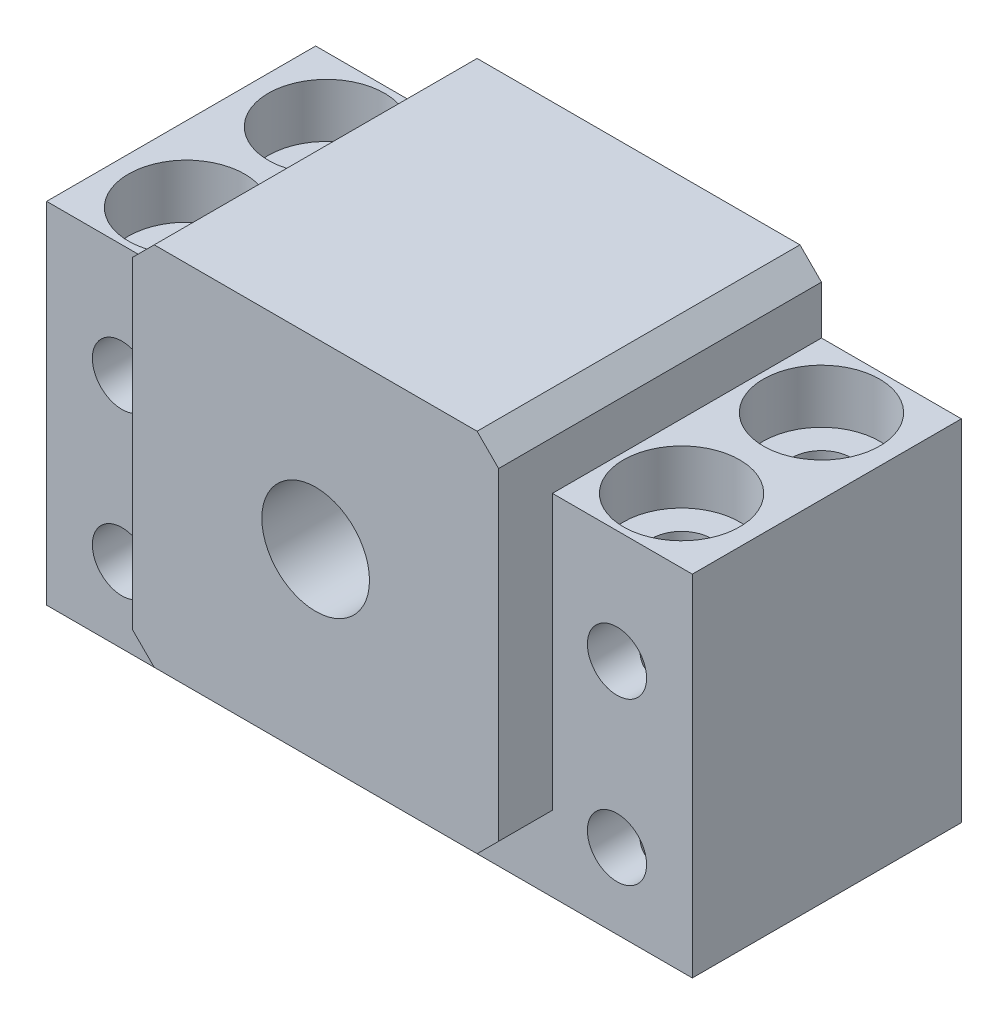
from build123d import *
from build123d.topology import SkipClean

# Parameters (mm, degrees)
SKETCH1_R           = 5
BOSS_EXTRUDE1_DEPTH = 5
BOSS_EXTRUDE2_START = 25
SKETCH2_R           = 5
SKETCH2_R_2         = 2.75
BOSS_EXTRUDE2_DEPTH = 25
SKETCH3_R           = 2.75
CUT_EXTRUDE1_DEPTH  = 56.190578906
SKETCH4_R           = 5.4
CUT_EXTRUDE2_DEPTH  = 5


with BuildPart() as part:
    # Sketch1 → Boss-Extrude1 (new body)
    with BuildSketch(Plane.XY):
        Polygon((15, 17), (-15, 17), (-17, 15), (-17, -15), (-15, -17), (15, -17), (17, -15), (17, 15), align=None)
        Circle(SKETCH1_R, mode=Mode.SUBTRACT)
    extrude(amount=BOSS_EXTRUDE1_DEPTH)

    # Sketch2 → Boss-Extrude2 (add)
    with SkipClean():  # the faces are left unmerged after this step: merging them gives an invalid solid
        with BuildSketch(Plane(origin=(0, 0, 0), x_dir=(-1, 0, 0), z_dir=(0, 0, -1)).offset(BOSS_EXTRUDE2_START)):
            Polygon((15, 17), (-15, 17), (-17, 15), (-17, 10.5), (-30, 10.5), (-30, -22), (30, -22), (30, 10.5), (17, 10.5), (17, 15), align=None)
            Circle(SKETCH2_R, mode=Mode.SUBTRACT)
            with Locations((-23, 0)):
                Circle(SKETCH2_R_2, mode=Mode.SUBTRACT)
            with Locations((-23, -15)):
                Circle(SKETCH2_R_2, mode=Mode.SUBTRACT)
            with Locations((23, -15)):
                Circle(SKETCH2_R_2, mode=Mode.SUBTRACT)
            with Locations((23, 0)):
                Circle(SKETCH2_R_2, mode=Mode.SUBTRACT)
        extrude(amount=-BOSS_EXTRUDE2_DEPTH)

    # Sketch3 → Cut-Extrude1 (cut, through all)
    with SkipClean():  # the faces are left unmerged after this step: merging them gives an invalid solid
        with BuildSketch(Plane.XZ.offset(22)):
            with Locations((-23, -6)):
                Circle(SKETCH3_R)
            with Locations((-23, -19)):
                Circle(SKETCH3_R)
            with Locations((23, -6)):
                Circle(SKETCH3_R)
            with Locations((23, -19)):
                Circle(SKETCH3_R)
        extrude(amount=-CUT_EXTRUDE1_DEPTH, mode=Mode.SUBTRACT)

    # Sketch4 → Cut-Extrude2 (cut)
    with SkipClean():  # the faces are left unmerged after this step: merging them gives an invalid solid
        with BuildSketch(Plane(origin=(0, 10.5, 0), x_dir=(1, 0, 0), z_dir=(0, 1, 0))):
            with Locations((23, 6)):
                Circle(SKETCH4_R)
            with Locations((23, 19)):
                Circle(SKETCH4_R)
            with Locations((-23, 19)):
                Circle(SKETCH4_R)
            with Locations((-23, 6)):
                Circle(SKETCH4_R)
        extrude(amount=-CUT_EXTRUDE2_DEPTH, mode=Mode.SUBTRACT)


solid = part.part
